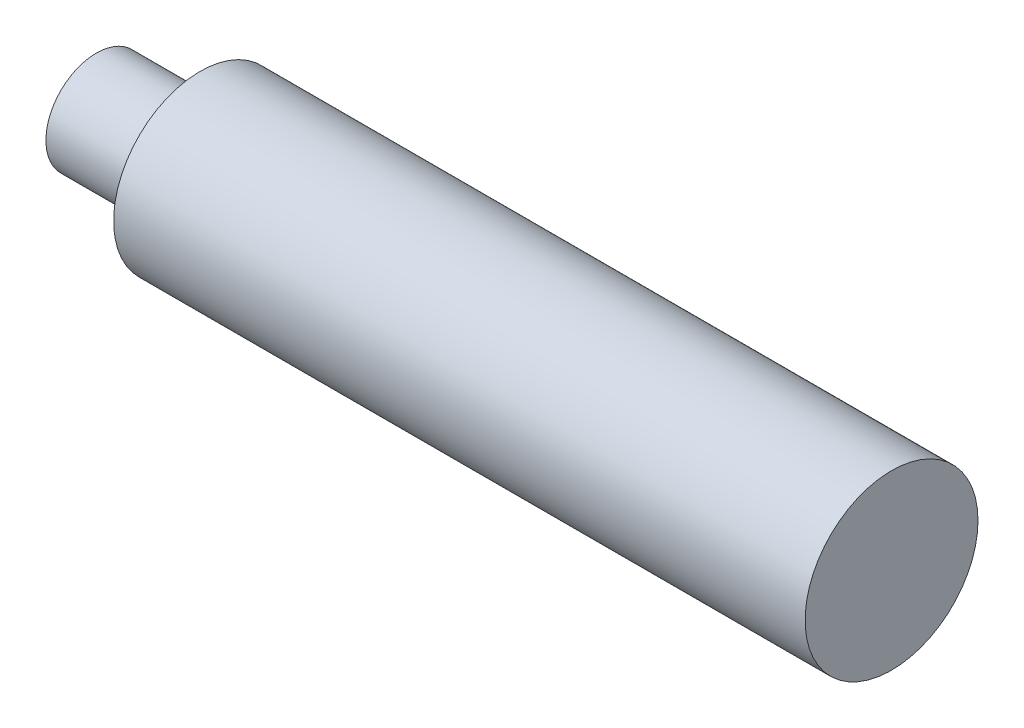
from build123d import *

# Parameters (mm, degrees)
INNER_CHAMBER_FILLETS_R = 2.54


with BuildPart() as part:
    # Sketch1 → Torch Body (revolve)
    with BuildSketch(Plane.XY):
        Polygon((0, 0), (0, 5.55625), (9.525, 5.55625), (9.525, 4.6228), (11.43, 4.6228), (11.43, 9.525), (87.63, 9.525), (87.63, 0), align=None)
    revolve(axis=Axis((87.63, 0, 0), (-1, 0, 0)))

    # Sketch2 → Chamber Cavity (revolve, cut)
    with BuildSketch(Plane(origin=(0, 0, 0), x_dir=(1, 0, 0), z_dir=(0, 1, 0))):
        Polygon((0, 0), (73.406, 0), (73.406, 2.794), (69.85, 6.35), (19.4564, 6.35), (14.605, 1.4986), (0, 1.4986), align=None)
    revolve(axis=Axis((0, 0, 0), (1, 0, 0)), mode=Mode.SUBTRACT)

    # Inner Chamber Fillets
    inner_chamber_fillets_edges = [part.edges().sort_by_distance(p)[0] for p in [
        (69.85, 0, 6.35),
        (19.4564, 0, 6.35),
        (14.605, 0, 1.4986),
    ]]
    fillet(inner_chamber_fillets_edges, radius=INNER_CHAMBER_FILLETS_R)


solid = part.part
